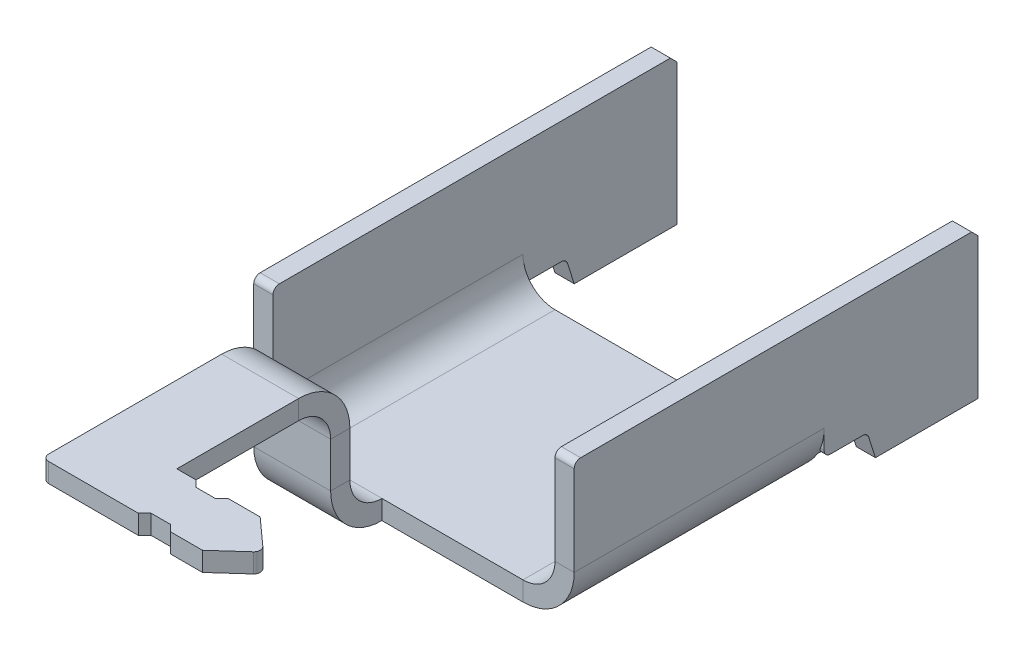
from build123d import *

# Parameters (mm, degrees)
SKETCH1_W                    = 12.7
SKETCH1_H                    = 9.906
BOSS_EXTRUDE1_DEPTH          = 0.762
EDGE_FLANGE1_STRIP_W         = 5.588
EDGE_FLANGE1_STRIP_H         = 0.762
EDGE_FLANGE1_STRIP_CUT_DEPTH = 9.906
EDGE_FLANGE1_DEPTH           = 9.906
TAB1_DEPTH                   = 0.762
EDGE_FLANGE2_DEPTH           = 8.636
EDGE_FLANGE3_STRIP_W         = 5.588
EDGE_FLANGE3_STRIP_H         = 0.762
EDGE_FLANGE3_STRIP_CUT_DEPTH = 8.636
EDGE_FLANGE3_DEPTH           = 8.636
CUT_EXTRUDE1_DEPTH           = 18.623738338
FILLET1_R                    = 0.254
FILLET2_R                    = 0.254
FILLET3_R                    = 0.254


# Sheet-metal steps are written as plain solids
with BuildPart() as part:
    # Sketch1 → Boss-Extrude1 (new body)
    with BuildSketch(Plane(origin=(0, 0, 0), x_dir=(1, 0, 0), z_dir=(0, 1, 0))):
        Rectangle(SKETCH1_W, SKETCH1_H)
    extrude(amount=BOSS_EXTRUDE1_DEPTH)

    # Edge-Flange1 strip (across the edge) → Edge-Flange1 strip cut (cut)
    with BuildSketch(Plane(origin=(6.35, 0.762, 4.953), x_dir=(-1, 0, 0), z_dir=(0, 0, -1))):
        with Locations((-0.762, -0.381)):
            Rectangle(EDGE_FLANGE1_STRIP_W, EDGE_FLANGE1_STRIP_H)
    edge_flange1_strip_cut = extrude(amount=EDGE_FLANGE1_STRIP_CUT_DEPTH, mode=Mode.SUBTRACT)

    # Edge-Flange1 section (across the edge) → Edge-Flange1 (add)
    with BuildSketch(Plane(origin=(6.35, 0.762, 4.953), x_dir=(-1, 0, 0), z_dir=(0, 0, -1))):
        with BuildLine():
            Line((0, 1.27), (0, 5.08))
            Line((0, 5.08), (0.762, 5.08))
            Line((0.762, 5.08), (0.762, 1.27))
            ThreePointArc((0.762, 1.27), (1.133974388, 0.371974388), (2.032, 0))
            Line((2.032, 0), (2.032, -0.762))
            ThreePointArc((2.032, -0.762), (0.595159021, -0.166840979), (0, 1.27))
        make_face()
    edge_flange1 = extrude(amount=EDGE_FLANGE1_DEPTH)

    # Sketch10 → Tab1 (add)
    with BuildSketch(Plane(origin=(6.35, 0, 0), x_dir=(0, 0, -1), z_dir=(1, 0, 0))):
        with BuildLine():
            Line((4.953, 5.842), (10.795, 5.842))
            Line((10.795, 5.842), (11.049, 5.588))
            Line((11.049, 5.588), (11.049, 0))
            Line((11.049, 0), (6.985, 0))
            Line((6.985, 0), (6.719126572, 0.838751048))
            ThreePointArc((6.719126572, 0.838751048), (6.627035386, 0.966952148), (6.477, 1.016))
            Line((6.477, 1.016), (4.953, 1.016))
            Line((4.953, 1.016), (4.953, 5.842))
        make_face()
    tab1 = extrude(amount=-TAB1_DEPTH)

    # Mirror1: Edge-Flange1 strip cut, Edge-Flange1, Tab1 across plane
    add(edge_flange1_strip_cut.mirror(Plane(origin=(0, 0, 0), x_dir=(0, 0, 1), z_dir=(1, 0, 0))), mode=Mode.SUBTRACT)
    add(edge_flange1.mirror(Plane(origin=(0, 0, 0), x_dir=(0, 0, 1), z_dir=(1, 0, 0))))
    add(tab1.mirror(Plane(origin=(0, 0, 0), x_dir=(0, 0, 1), z_dir=(1, 0, 0))))

    # Edge-Flange2 section (across the edge) → Edge-Flange2 (add)
    with BuildSketch(Plane(origin=(-4.318, 0.762, 6.223), x_dir=(0, 0, -1), z_dir=(1, 0, 0))):
        with BuildLine():
            Line((-0.762, 1.27), (-0.762, 5.08))
            Line((-0.762, 5.08), (0, 5.08))
            Line((0, 5.08), (0, 1.27))
            ThreePointArc((0, 1.27), (0.371974388, 0.371974388), (1.27, 0))
            Line((1.27, 0), (1.27, -0.762))
            ThreePointArc((1.27, -0.762), (-0.166840979, -0.166840979), (-0.762, 1.27))
        make_face()
    extrude(amount=EDGE_FLANGE2_DEPTH)

    # Edge-Flange3 strip (across the edge) → Edge-Flange3 strip cut (cut)
    with BuildSketch(Plane(origin=(4.318, 5.842, 6.985), x_dir=(0, -1, 0), z_dir=(-1, 0, 0))):
        with Locations((-0.762, -0.381)):
            Rectangle(EDGE_FLANGE3_STRIP_W, EDGE_FLANGE3_STRIP_H)
    extrude(amount=EDGE_FLANGE3_STRIP_CUT_DEPTH, mode=Mode.SUBTRACT)

    # Edge-Flange3 section (across the edge) → Edge-Flange3 (add)
    with BuildSketch(Plane(origin=(4.318, 5.842, 6.985), x_dir=(0, -1, 0), z_dir=(-1, 0, 0))):
        with BuildLine():
            Line((0, 1.27), (0, 8.382))
            Line((0, 8.382), (0.762, 8.382))
            Line((0.762, 8.382), (0.762, 1.27))
            ThreePointArc((0.762, 1.27), (1.133974388, 0.371974388), (2.032, 0))
            Line((2.032, 0), (2.032, -0.762))
            ThreePointArc((2.032, -0.762), (0.595159021, -0.166840979), (0, 1.27))
        make_face()
    extrude(amount=EDGE_FLANGE3_DEPTH)

    # Sketch24 → Cut-Extrude1 (cut, through all)
    with BuildSketch(Plane(origin=(0, 5.842, 0), x_dir=(1, 0, 0), z_dir=(0, 1, 0))):
        Polygon((4.318, -4.953), (-1.27, -4.953), (-1.27, -13.081), (-0.508, -13.081), (-0.254, -13.335), (0.508, -13.335), (0.762, -13.081), (2.032, -13.081), (3.302, -14.224), (2.032, -15.367), (4.318, -15.367), align=None)
        Polygon((-0.508, -15.367), (0.762, -15.367), (0.508, -15.113), (-0.254, -15.113), align=None)
    extrude(amount=-CUT_EXTRUDE1_DEPTH, mode=Mode.SUBTRACT)

    # Fillet1
    fillet1_edges = [part.edges().sort_by_distance(p)[0] for p in [
        (-4.318, 5.461, 15.367),
        (3.302, 5.461, 14.224),
    ]]
    fillet(fillet1_edges, radius=FILLET1_R)

    # Fillet2
    fillet2_edges = [part.edges().sort_by_distance(p)[0] for p in [
        (5.969, 5.842, 4.953),
        (-5.969, 5.842, 4.953),
    ]]
    fillet(fillet2_edges, radius=FILLET2_R)

    # Fillet3
    fillet3_edges = [part.edges().sort_by_distance(p)[0] for p in [
        (-6.21388181, 1.016, -4.953),
        (6.21388181, 1.016, -4.953),
    ]]
    fillet(fillet3_edges, radius=FILLET3_R)


solid = part.part
